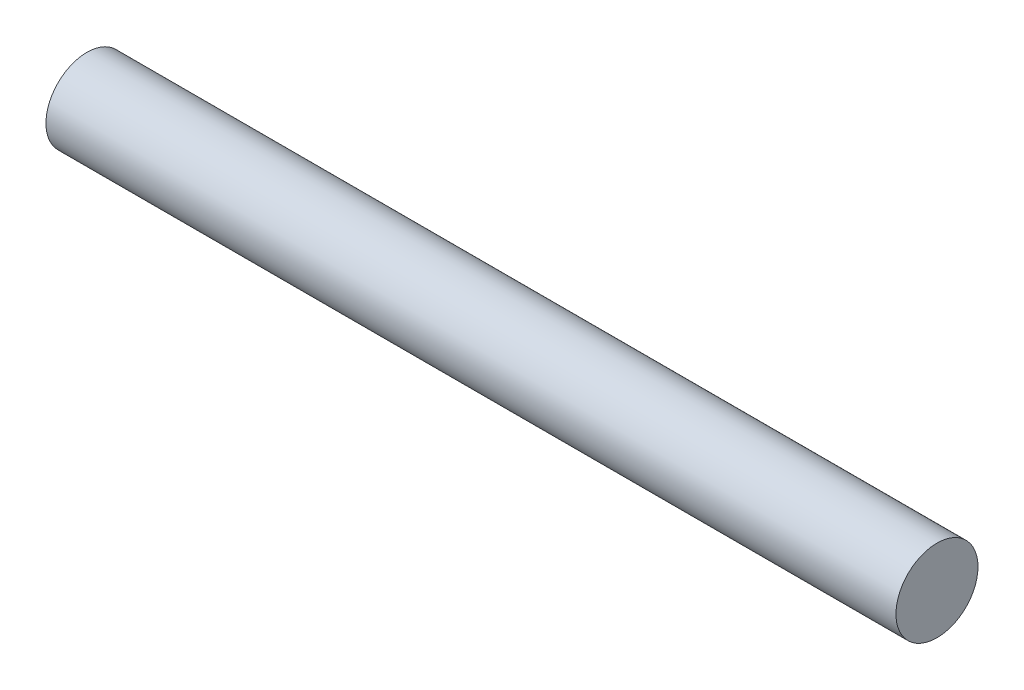
from build123d import *

# Parameters (mm, degrees)
SKETCH1_R           = 2.413
BOSS_EXTRUDE1_DEPTH = 50


with BuildPart() as part:
    # Sketch1 → Boss-Extrude1 (new body)
    with BuildSketch(Plane(origin=(0, 0, 0), x_dir=(0, 0, -1), z_dir=(1, 0, 0))):
        Circle(SKETCH1_R)
    extrude(amount=BOSS_EXTRUDE1_DEPTH)


solid = part.part
